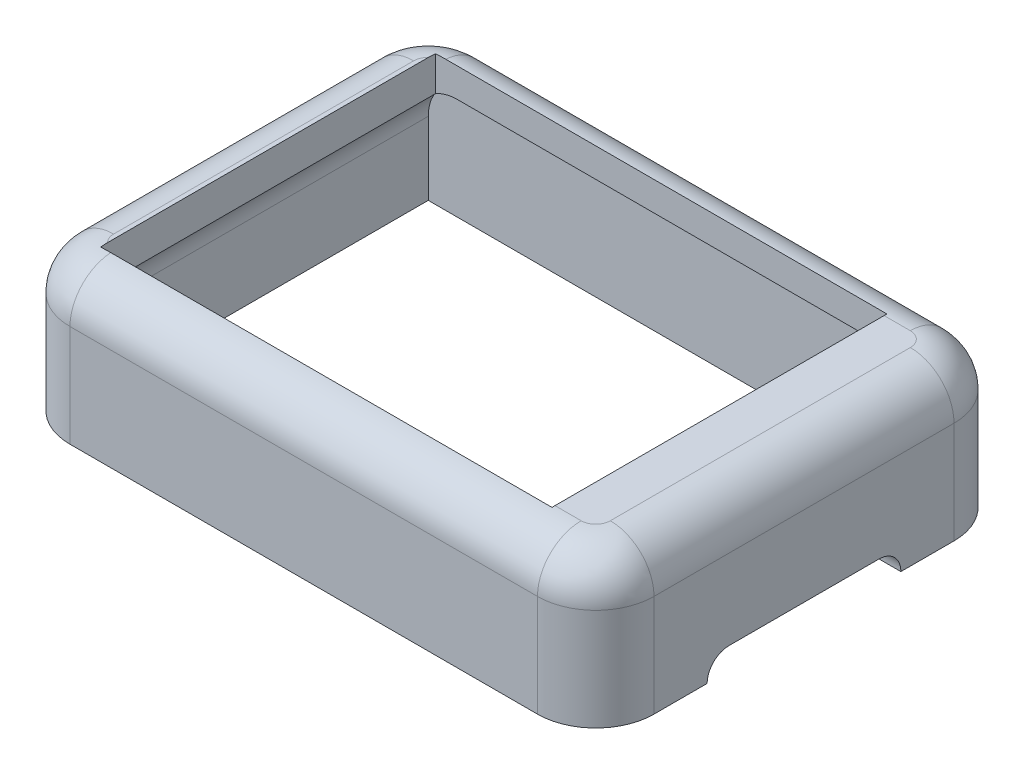
from build123d import *

# Parameters (mm, degrees)
SKETCH1_W           = 40.1
SKETCH1_H           = 28.6
SKETCH1_W_2         = 36.5
SKETCH1_H_2         = 25
BOSS_EXTRUDE1_DEPTH = 8
SKETCH2_W           = 40.1
SKETCH2_H           = 28.6
SKETCH2_W_2         = 31
SKETCH2_H_2         = 23
BOSS_EXTRUDE2_DEPTH = 2
FILLET1_R           = 4
FILLET4_R           = 3
FILLET5_R           = 3
CUT_EXTRUDE1_REACH  = 45.732


with BuildPart() as part:
    # Sketch1 → Boss-Extrude1 (new body)
    with BuildSketch(Plane(origin=(0, 0, 0), x_dir=(1, 0, 0), z_dir=(0, 1, 0))):
        Rectangle(SKETCH1_W, SKETCH1_H)
        Rectangle(SKETCH1_W_2, SKETCH1_H_2, mode=Mode.SUBTRACT)
    extrude(amount=BOSS_EXTRUDE1_DEPTH)

    # Sketch2 → Boss-Extrude2 (add)
    with BuildSketch(Plane(origin=(0, 8, 0), x_dir=(1, 0, 0), z_dir=(0, 1, 0))):
        Rectangle(SKETCH2_W, SKETCH2_H)
        with Locations((-1.25, 0)):
            Rectangle(SKETCH2_W_2, SKETCH2_H_2, mode=Mode.SUBTRACT)
    extrude(amount=BOSS_EXTRUDE2_DEPTH)

    # Fillet1
    fillet1_edges = [part.edges().sort_by_distance(p)[0] for p in [
        (20.05, 5, 14.3),
        (-20.05, 5, 14.3),
        (-20.05, 5, -14.3),
        (20.05, 5, -14.3),
    ]]
    fillet(fillet1_edges, radius=FILLET1_R)

    # Fillet4
    # the kernel refuses this fillet: 3 mm, written as the material it takes off along each edge
    with BuildSketch(Plane(origin=(-20.05, 10, 10.3), x_dir=(1, 0, 0), z_dir=(0, 0, -1)), Plane(origin=(20.05, 10, -10.3), x_dir=(-1, 0, 0), z_dir=(0, 0, 1))) as fillet4_piece_1:
        with BuildLine():
            CenterArc((FILLET4_R, FILLET4_R), FILLET4_R, 180, 90)
            Line((0, FILLET4_R), (0, 0))
            Line((0, 0), (FILLET4_R, 0))
        make_face()
    extrude(amount=20.6, mode=Mode.SUBTRACT)
    with BuildSketch(Plane(origin=(-16.05, 10, -10.3), x_dir=(0, 0, -1), z_dir=(1, 0, 0))) as fillet4_piece_2:
        with BuildLine():
            CenterArc((4 - FILLET4_R, -FILLET4_R), FILLET4_R, 0, 90)
            Line((4, -FILLET4_R), (4, 0))
            Line((4, 0), (4 - FILLET4_R, 0))
        make_face()
    revolve(axis=Axis((-16.05, 10, -10.3), (0, 1, 0)), revolution_arc=90, mode=Mode.SUBTRACT)
    with BuildSketch(Plane(origin=(-16.05, 10, -14.3), x_dir=(0, 0, 1), z_dir=(1, 0, 0))) as fillet4_piece_3:
        with BuildLine():
            CenterArc((FILLET4_R, FILLET4_R), FILLET4_R, 180, 90)
            Line((0, FILLET4_R), (0, 0))
            Line((0, 0), (FILLET4_R, 0))
        make_face()
    extrude(amount=32.1, mode=Mode.SUBTRACT)
    with BuildSketch(Plane(origin=(16.05, 10, -10.3), x_dir=(0, 0, -1), z_dir=(-1, 0, 0))) as fillet4_piece_4:
        with BuildLine():
            CenterArc((4 - FILLET4_R, FILLET4_R), FILLET4_R, 270, 90)
            Line((4, FILLET4_R), (4, 0))
            Line((4, 0), (4 - FILLET4_R, 0))
        make_face()
    revolve(axis=Axis((16.05, 10, -10.3), (0, -1, 0)), revolution_arc=90, mode=Mode.SUBTRACT)
    with BuildSketch(Plane(origin=(16.05, 10, 10.3), x_dir=(0, 0, 1), z_dir=(-1, 0, 0))) as fillet4_piece_5:
        with BuildLine():
            CenterArc((4 - FILLET4_R, -FILLET4_R), FILLET4_R, 360, 90)
            Line((4, -FILLET4_R), (4, 0))
            Line((4, 0), (4 - FILLET4_R, 0))
        make_face()
    revolve(axis=Axis((16.05, 10, 10.3), (0, 1, 0)), revolution_arc=90, mode=Mode.SUBTRACT)
    with BuildSketch(Plane(origin=(16.05, 10, 14.3), x_dir=(0, -1, 0), z_dir=(-1, 0, 0))) as fillet4_piece_6:
        with BuildLine():
            CenterArc((FILLET4_R, -FILLET4_R), FILLET4_R, 90, 90)
            Line((0, -FILLET4_R), (0, 0))
            Line((0, 0), (FILLET4_R, 0))
        make_face()
    extrude(amount=32.1, mode=Mode.SUBTRACT)
    with BuildSketch(Plane(origin=(-16.05, 10, 10.3), x_dir=(0, 0, 1), z_dir=(1, 0, 0))) as fillet4_piece_7:
        with BuildLine():
            CenterArc((4 - FILLET4_R, FILLET4_R), FILLET4_R, 270, 90)
            Line((4, FILLET4_R), (4, 0))
            Line((4, 0), (4 - FILLET4_R, 0))
        make_face()
    revolve(axis=Axis((-16.05, 10, 10.3), (0, -1, 0)), revolution_arc=90, mode=Mode.SUBTRACT)

    # Fillet5
    # the kernel refuses this fillet: 3 mm, written as the material it adds along each edge
    with BuildSketch(Plane(origin=(-18.25, 8, 12.5), x_dir=(0, -1, 0), z_dir=(0, 0, -1))) as fillet5_piece_1_section:
        with BuildLine():
            CenterArc((FILLET5_R, -FILLET5_R), FILLET5_R, 90, 90)
            Line((0, -FILLET5_R), (0, 0))
            Line((0, 0), (FILLET5_R, 0))
        make_face()
    fillet5_piece_1 = extrude(amount=25, mode=Mode.PRIVATE)
    fillet5_piece_1 = split(fillet5_piece_1, bisect_by=Plane(origin=(-16.75, 7.23463982, 12), z_dir=(-1, 0, 0)), keep=Keep.TOP, mode=Mode.PRIVATE)
    fillet5_piece_1 = split(fillet5_piece_1, bisect_by=Plane(origin=(-17.756824707, 7.23463982, 11.5), z_dir=(0, 0, 1)), keep=Keep.TOP, mode=Mode.PRIVATE)
    add(fillet5_piece_1)
    with BuildSketch(Plane(origin=(-18.25, 8, 12.5), x_dir=(0, -1, 0), z_dir=(0, 0, -1))) as fillet5_piece_2_section:
        with BuildLine():
            CenterArc((FILLET5_R, -FILLET5_R), FILLET5_R, 90, 90)
            Line((0, -FILLET5_R), (0, 0))
            Line((0, 0), (FILLET5_R, 0))
        make_face()
    fillet5_piece_2 = extrude(amount=25, mode=Mode.PRIVATE)
    fillet5_piece_2 = split(fillet5_piece_2, bisect_by=Plane(origin=(-16.75, 7.927974855, 12), z_dir=(1, 0, 0)), keep=Keep.TOP, mode=Mode.PRIVATE)
    fillet5_piece_2 = split(fillet5_piece_2, bisect_by=Plane(origin=(-16.260247646, 7.927974855, 11.5), z_dir=(0, 0, 1)), keep=Keep.TOP, mode=Mode.PRIVATE)
    add(fillet5_piece_2)
    with BuildSketch(Plane(origin=(-18.25, 8, 12.5), x_dir=(0, -1, 0), z_dir=(0, 0, -1))) as fillet5_piece_3_section:
        with BuildLine():
            CenterArc((FILLET5_R, -FILLET5_R), FILLET5_R, 90, 90)
            Line((0, -FILLET5_R), (0, 0))
            Line((0, 0), (FILLET5_R, 0))
        make_face()
    fillet5_piece_3 = extrude(amount=25, mode=Mode.PRIVATE)
    fillet5_piece_3 = split(fillet5_piece_3, bisect_by=Plane(origin=(-16.75, 7.23463982, 0), z_dir=(-1, 0, 0)), keep=Keep.TOP, mode=Mode.PRIVATE)
    fillet5_piece_3 = split(fillet5_piece_3, bisect_by=Plane(origin=(-17.756824707, 7.23463982, 11.5), z_dir=(0, 0, -1)), keep=Keep.TOP, mode=Mode.PRIVATE)
    fillet5_piece_3 = split(fillet5_piece_3, bisect_by=Plane(origin=(-17.756824707, 7.23463982, -11.5), z_dir=(0, 0, 1)), keep=Keep.TOP, mode=Mode.PRIVATE)
    add(fillet5_piece_3)
    with BuildSketch(Plane(origin=(-18.25, 8, 12.5), x_dir=(0, -1, 0), z_dir=(0, 0, -1))) as fillet5_piece_4_section:
        with BuildLine():
            CenterArc((FILLET5_R, -FILLET5_R), FILLET5_R, 90, 90)
            Line((0, -FILLET5_R), (0, 0))
            Line((0, 0), (FILLET5_R, 0))
        make_face()
    fillet5_piece_4 = extrude(amount=25, mode=Mode.PRIVATE)
    fillet5_piece_4 = split(fillet5_piece_4, bisect_by=Plane(origin=(-16.75, 7.23463982, -12), z_dir=(-1, 0, 0)), keep=Keep.TOP, mode=Mode.PRIVATE)
    fillet5_piece_4 = split(fillet5_piece_4, bisect_by=Plane(origin=(-17.756824707, 7.23463982, -11.5), z_dir=(0, 0, -1)), keep=Keep.TOP, mode=Mode.PRIVATE)
    add(fillet5_piece_4)
    with BuildSketch(Plane(origin=(-18.25, 8, 12.5), x_dir=(0, -1, 0), z_dir=(0, 0, -1))) as fillet5_piece_5_section:
        with BuildLine():
            CenterArc((FILLET5_R, -FILLET5_R), FILLET5_R, 90, 90)
            Line((0, -FILLET5_R), (0, 0))
            Line((0, 0), (FILLET5_R, 0))
        make_face()
    fillet5_piece_5 = extrude(amount=25, mode=Mode.PRIVATE)
    fillet5_piece_5 = split(fillet5_piece_5, bisect_by=Plane(origin=(-16.75, 7.927974855, -12), z_dir=(1, 0, 0)), keep=Keep.TOP, mode=Mode.PRIVATE)
    fillet5_piece_5 = split(fillet5_piece_5, bisect_by=Plane(origin=(-16.260247646, 7.927974855, -11.5), z_dir=(0, 0, -1)), keep=Keep.TOP, mode=Mode.PRIVATE)
    add(fillet5_piece_5)
    with BuildSketch(Plane(origin=(18.25, 8, -12.5), x_dir=(0, -1, 0), z_dir=(0, 0, 1))) as fillet5_piece_6:
        with BuildLine():
            CenterArc((FILLET5_R, -FILLET5_R), FILLET5_R, 90, 90)
            Line((0, -FILLET5_R), (0, 0))
            Line((0, 0), (FILLET5_R, 0))
        make_face()
    extrude(amount=25)

    # Sketch3 → Cut-Extrude1 (cut, up to next)
    with BuildSketch(Plane(origin=(20.05, 0, 0), x_dir=(0, 0, -1), z_dir=(1, 0, 0)), mode=Mode.PRIVATE) as cut_extrude1_sk1:
        with BuildLine():
            Line((5.15, -1.5), (-5.15, -1.5))
            ThreePointArc((-5.15, -1.5), (-6.65, 0), (-5.15, 1.5))
            Line((-5.15, 1.5), (5.15, 1.5))
            ThreePointArc((5.15, 1.5), (6.65, 0), (5.15, -1.5))
        make_face()
    cut_extrude1_tool1 = extrude(cut_extrude1_sk1.sketch, amount=-CUT_EXTRUDE1_REACH, mode=Mode.PRIVATE) & part.part
    add(cut_extrude1_tool1.solids().sort_by_distance((20.05, 0, 0))[0], mode=Mode.SUBTRACT)


solid = part.part
